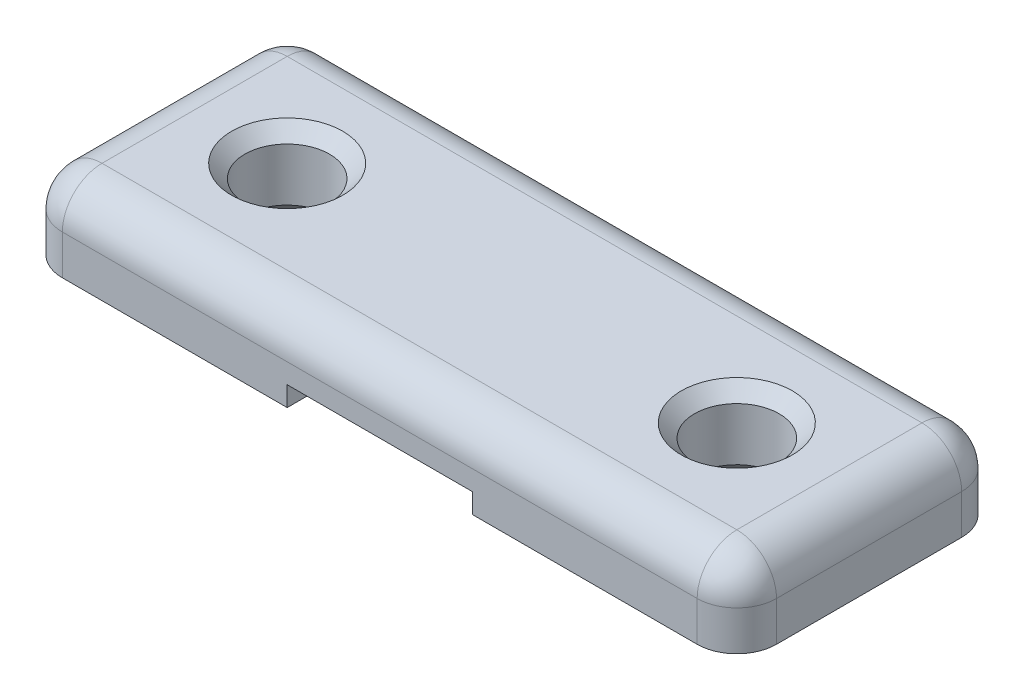
from build123d import *

# Parameters (mm, degrees)
SKETCH_1_W          = 27
SKETCH_1_H          = 10
SKETCH_1_R          = 1.6
EXTRUDE_1_DEPTH     = 3
CUT_EXTRUDE_1_DEPTH = 3.5
FILLET_1_R          = 1.5
CHAMFER_1_SIZE      = 0.5


with BuildPart() as part:
    # Эскиз1 → Бобышка-Вытянуть1 (new body)
    with BuildSketch(Plane(origin=(0, 0, 0), x_dir=(1, 0, 0), z_dir=(0, 1, 0))):
        Rectangle(SKETCH_1_W, SKETCH_1_H)
        with Locations((-8.5, 0)):
            Circle(SKETCH_1_R, mode=Mode.SUBTRACT)
        with Locations((8.5, 0)):
            Circle(SKETCH_1_R, mode=Mode.SUBTRACT)
    extrude(amount=EXTRUDE_1_DEPTH)

    # Эскиз2 → Вырез-Вытянуть1 (cut, symmetric)
    with BuildSketch(Plane(origin=(0, 0, 0), x_dir=(0, 0, -1), z_dir=(1, 0, 0))):
        with BuildLine():
            ThreePointArc((-4.594594195, 0.619565217), (-4.644405657, 0.712771412), (-4.743312728, 0.75))
            Line((-4.743312728, 0.75), (-5, 0.75))
            Line((-5, 0.75), (-5, 0))
            Line((-5, 0), (-4, 0))
            ThreePointArc((-4, 0), (-4.298481003, 0.086176097), (-4.505097978, 0.318181818))
            ThreePointArc((-4.505097978, 0.318181818), (-4.56176419, 0.46533442), (-4.594594195, 0.619565217))
        make_face()
        with BuildLine():
            ThreePointArc((4.505097978, 0.318181818), (4.298481003, 0.086176097), (4, 0))
            Line((4, 0), (5, 0))
            Line((5, 0), (5, 0.75))
            Line((5, 0.75), (4.743312728, 0.75))
            ThreePointArc((4.743312728, 0.75), (4.644405657, 0.712771412), (4.594594195, 0.619565217))
            ThreePointArc((4.594594195, 0.619565217), (4.56176419, 0.46533442), (4.505097978, 0.318181818))
        make_face()
        with BuildLine():
            ThreePointArc((2.505097978, 0.318181818), (2.298481003, 0.086176097), (2, 0))
            Line((2, 0), (4, 0))
            ThreePointArc((4, 0), (3.701518997, 0.086176097), (3.494902022, 0.318181818))
            ThreePointArc((3.494902022, 0.318181818), (3.43823581, 0.46533442), (3.405405805, 0.619565217))
            ThreePointArc((3.405405805, 0.619565217), (3.355594343, 0.712771412), (3.256687272, 0.75))
            Line((3.256687272, 0.75), (2.743312728, 0.75))
            ThreePointArc((2.743312728, 0.75), (2.644405657, 0.712771412), (2.594594195, 0.619565217))
            ThreePointArc((2.594594195, 0.619565217), (2.56176419, 0.46533442), (2.505097978, 0.318181818))
        make_face()
        with BuildLine():
            ThreePointArc((0.505097978, 0.318181818), (0.298481003, 0.086176097), (0, 0))
            Line((0, 0), (2, 0))
            ThreePointArc((2, 0), (1.701518997, 0.086176097), (1.494902022, 0.318181818))
            ThreePointArc((1.494902022, 0.318181818), (1.43823581, 0.46533442), (1.405405805, 0.619565217))
            ThreePointArc((1.405405805, 0.619565217), (1.355594343, 0.712771412), (1.256687272, 0.75))
            Line((1.256687272, 0.75), (0.743312728, 0.75))
            ThreePointArc((0.743312728, 0.75), (0.644405657, 0.712771412), (0.594594195, 0.619565217))
            ThreePointArc((0.594594195, 0.619565217), (0.56176419, 0.46533442), (0.505097978, 0.318181818))
        make_face()
        with BuildLine():
            ThreePointArc((-1.494902022, 0.318181818), (-1.701518997, 0.086176097), (-2, 0))
            Line((-2, 0), (0, 0))
            ThreePointArc((0, 0), (-0.298481003, 0.086176097), (-0.505097978, 0.318181818))
            ThreePointArc((-0.505097978, 0.318181818), (-0.56176419, 0.46533442), (-0.594594195, 0.619565217))
            ThreePointArc((-0.594594195, 0.619565217), (-0.644405657, 0.712771412), (-0.743312728, 0.75))
            Line((-0.743312728, 0.75), (-1.256687272, 0.75))
            ThreePointArc((-1.256687272, 0.75), (-1.355594343, 0.712771412), (-1.405405805, 0.619565217))
            ThreePointArc((-1.405405805, 0.619565217), (-1.43823581, 0.46533442), (-1.494902022, 0.318181818))
        make_face()
        with BuildLine():
            ThreePointArc((-3.494902022, 0.318181818), (-3.701518997, 0.086176097), (-4, 0))
            Line((-4, 0), (-2, 0))
            ThreePointArc((-2, 0), (-2.298481003, 0.086176097), (-2.505097978, 0.318181818))
            ThreePointArc((-2.505097978, 0.318181818), (-2.56176419, 0.46533442), (-2.594594195, 0.619565217))
            ThreePointArc((-2.594594195, 0.619565217), (-2.644405657, 0.712771412), (-2.743312728, 0.75))
            Line((-2.743312728, 0.75), (-3.256687272, 0.75))
            ThreePointArc((-3.256687272, 0.75), (-3.355594343, 0.712771412), (-3.405405805, 0.619565217))
            ThreePointArc((-3.405405805, 0.619565217), (-3.43823581, 0.46533442), (-3.494902022, 0.318181818))
        make_face()
    extrude(amount=CUT_EXTRUDE_1_DEPTH, both=True, mode=Mode.SUBTRACT)

    # Скругление1
    fillet_1_edges = [part.edges().sort_by_distance(p)[0] for p in [
        (-13.5, 1.5, -5),
        (-13.5, 1.5, 5),
        (13.5, 1.5, 5),
        (13.5, 1.5, -5),
        (13.5, 3, 0),
        (0, 3, 5),
        (-13.5, 3, 0),
        (0, 3, -5),
    ]]
    fillet(fillet_1_edges, radius=FILLET_1_R)

    # Фаска1
    chamfer_1_edges = [part.edges().sort_by_distance(p)[0] for p in [
        (6.9, 3, 0),
        (-10.1, 3, 0),
        (-10.1, 0, 0),
        (6.9, 0, 0),
    ]]
    chamfer(chamfer_1_edges, length=CHAMFER_1_SIZE)


solid = part.part
